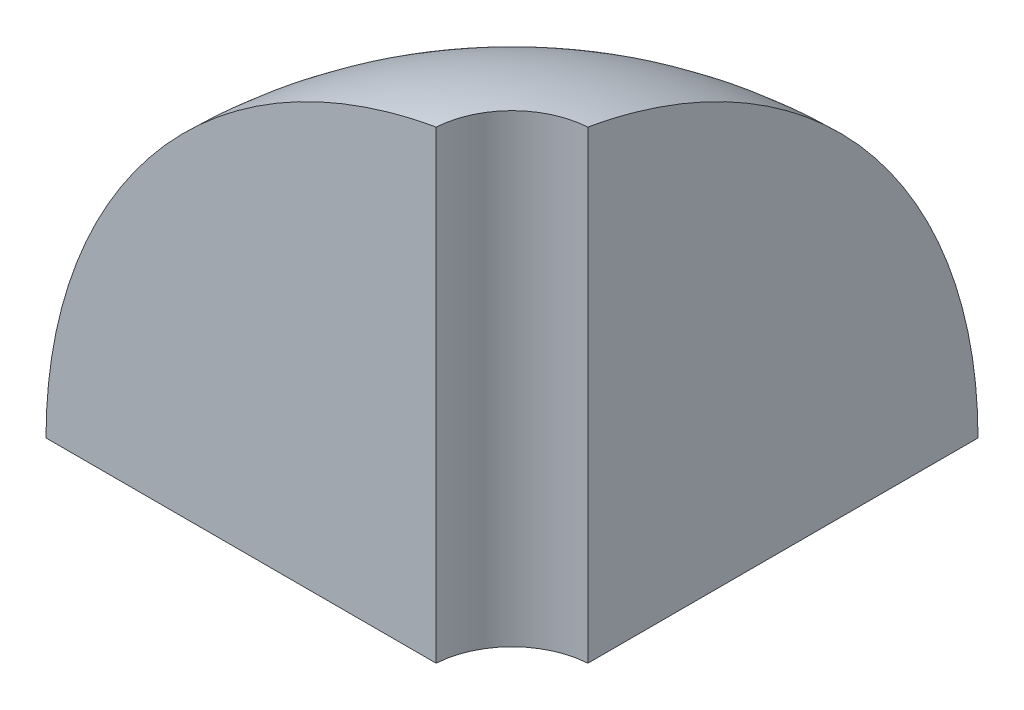
from build123d import *

# Parameters (mm, degrees)
CUT_EXTRUDE1_DEPTH      = 77.210235533
CUT_EXTRUDE1_DEPTH_BACK = 77.210235533
SKETCH3_W               = 43.997158999
SKETCH3_H               = 43.997158999
CUT_EXTRUDE2_DEPTH      = 76.916090791
SKETCH6_R               = 7.6
CUT_EXTRUDE3_DEPTH      = 77.203674452


with BuildPart() as part:
    # Sketch1 → Revolve1 (revolve)
    with BuildSketch(Plane.XY):
        with BuildLine():
            Line((0, 44), (0, -44))
            ThreePointArc((0, -44), (-44, 0), (0, 44))
        make_face()
    revolve(axis=Axis((0, 44, 0), (0, -1, 0)))

    # Sketch2 → Cut-Extrude1 (cut, two sides: drawn at the far end of the back side and taken through both)
    with BuildSketch(Plane(origin=(0, 0, 0), x_dir=(1, 0, 0), z_dir=(0, 1, 0)).offset(-CUT_EXTRUDE1_DEPTH_BACK)):
        with BuildLine():
            Line((-0.5, 43.997158999), (-0.5, 0.5))
            Line((-0.5, 0.5), (-43.997158999, 0.5))
            ThreePointArc((-43.997158999, 0.5), (31.112698372, -31.112698372), (-0.5, 43.997158999))
        make_face()
    extrude(amount=CUT_EXTRUDE1_DEPTH + CUT_EXTRUDE1_DEPTH_BACK, mode=Mode.SUBTRACT)

    # Sketch3 → Cut-Extrude2 (cut, through all)
    with BuildSketch(Plane(origin=(-0.5, 0, 0), x_dir=(0, 0, -1), z_dir=(1, 0, 0))):
        with Locations((21.998579499, -21.998579499)):
            Rectangle(SKETCH3_W, SKETCH3_H)
    extrude(amount=-CUT_EXTRUDE2_DEPTH, mode=Mode.SUBTRACT)

    # Sketch6 → Cut-Extrude3 (cut, through all)
    with BuildSketch(Plane.XZ):
        Circle(SKETCH6_R)
    extrude(amount=-CUT_EXTRUDE3_DEPTH, mode=Mode.SUBTRACT)


solid = part.part
